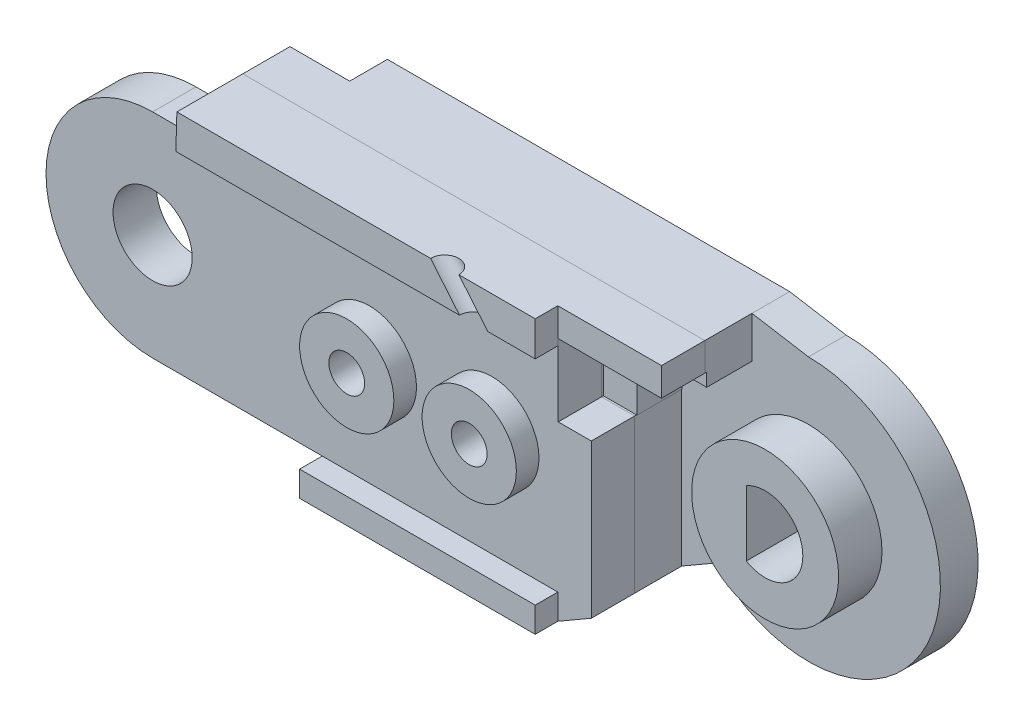
from build123d import *

# Parameters (mm, degrees)
BOSS_EXTRUDE1_DEPTH  = 2
BOSS_EXTRUDE6_DEPTH  = 2.5
CUT_EXTRUDE6_DEPTH   = 2.5
BOSS_EXTRUDE14_DEPTH = 2.3
SKETCH32_R           = 2.1
CUT_EXTRUDE7_DEPTH   = 2.3
SKETCH33_W           = 12.5
SKETCH33_H           = 1.343145751
BOSS_EXTRUDE15_DEPTH = 1.2
SKETCH35_W           = 5.479645997
SKETCH35_H           = 3.827993755
CUT_EXTRUDE8_DEPTH   = 2.4
SKETCH36_W           = 3.7
SKETCH36_H           = 1.827993755
CUT_EXTRUDE9_DEPTH   = 2.4
SKETCH37_R           = 3.9
BOSS_EXTRUDE16_DEPTH = 2.3
CUT_EXTRUDE10_DEPTH  = 38.996578793
SKETCH43_R           = 2.5
BOSS_EXTRUDE17_DEPTH = 1.2
SKETCH44_R           = 0.95
CUT_EXTRUDE11_DEPTH  = 39.590802013
SKETCH45_R           = 2
CUT_EXTRUDE12_DEPTH  = 2.5
SKETCH52_R           = 0.75
CUT_EXTRUDE13_DEPTH  = 10


with BuildPart() as part:
    # Sketch3 → Boss-Extrude1 (new body)
    with BuildSketch(Plane.XY):
        with BuildLine():
            Line((8, 0), (9, -2.5))
            Line((9, -2.5), (9, -7))
            Line((9, -7), (21.5, -7))
            Line((21.5, -7), (25.050252532, -4.949747468))
            ThreePointArc((25.050252532, -4.949747468), (36.467156728, -2.678784027), (30, 7))
            Line((30, 7), (27, 7.5))
            Line((27, 7.5), (5.656854249, 7.5))
            Line((5.656854249, 7.5), (5.656854249, 5.656854249))
            ThreePointArc((5.656854249, 5.656854249), (7.39103626, 3.061467459), (8, 0))
        make_face()
    extrude(amount=BOSS_EXTRUDE1_DEPTH)

    # Sketch22 → Boss-Extrude6 (add)
    with BuildSketch(Plane.XY.offset(2)):
        with BuildLine():
            Line((5.656854249, 5.656854249), (2.486790148, 5.656854249))
            Line((2.486790148, 5.656854249), (2.486790148, 7.5))
            Line((2.486790148, 7.5), (5.656854249, 7.5))
            Line((5.656854249, 7.5), (21.5, 7.5))
            Line((21.5, 7.5), (27, 7.5))
            Line((27, 7.5), (27, 2.172006245))
            Line((27, 2.172006245), (23.275126266, 2.172006245))
            Line((23.275126266, 2.172006245), (23.275126266, -5.974873734))
            Line((23.275126266, -5.974873734), (21.5, -7))
            Line((21.5, -7), (9, -7))
            Line((9, -7), (9, -2.5))
            Line((9, -2.5), (8, 0))
            ThreePointArc((8, 0), (7.39103626, 3.061467459), (5.656854249, 5.656854249))
        make_face()
    extrude(amount=BOSS_EXTRUDE6_DEPTH)

    # Sketch26 → Cut-Extrude6 (cut)
    with BuildSketch(Plane.XY.offset(2)):
        Polygon((18.098080448, 5.3), (2.530052458, 5.3), (2.530052458, 4), (18.098080448, 4), (27, 4), (27, 5.3), align=None)
    extrude(amount=CUT_EXTRUDE6_DEPTH, mode=Mode.SUBTRACT)


with BuildPart() as body_2:
    # Sketch31 → Boss-Extrude14 (new body)
    with BuildSketch(Plane.XY.offset(4.5)):
        with BuildLine():
            Line((2.432688066, 5.656854249), (0, 5.656854249))
            ThreePointArc((0, 5.656854249), (-5.656854249, 0), (0, -5.656854249))
            Line((0, -5.656854249), (9, -5.656854249))
            Line((9, -5.656854249), (9, -7))
            Line((9, -7), (21.5, -7))
            Line((21.5, -7), (23.275126266, -5.974873734))
            Line((23.275126266, -5.974873734), (23.275126266, 2.172006245))
            Line((23.275126266, 2.172006245), (27, 2.172006245))
            Line((27, 2.172006245), (27, 7.5))
            Line((27, 7.5), (2.486790148, 7.5))
            Line((2.486790148, 7.5), (2.432688066, 5.656854249))
        make_face()
    extrude(amount=BOSS_EXTRUDE14_DEPTH)

    # Sketch32 → Cut-Extrude7 (cut)
    with BuildSketch(Plane.XY.offset(6.8)):
        Circle(SKETCH32_R)
    extrude(amount=-CUT_EXTRUDE7_DEPTH, mode=Mode.SUBTRACT)

    # Sketch33 → Boss-Extrude15 (add)
    with BuildSketch(Plane.XY.offset(6.8)):
        with Locations((15.25, -6.328427125)):
            Rectangle(SKETCH33_W, SKETCH33_H)
        Polygon((2.486790148, 7.5), (21.5, 7.5), (21.5, 5.656854249), (2.432688066, 5.656854249), align=None)
    extrude(amount=BOSS_EXTRUDE15_DEPTH)


with BuildPart() as cut_extrude8_tool:
    # Sketch35 → Cut-Extrude8 (new body)
    with BuildSketch(Plane.XY.offset(6.8)):
        with Locations((24.260177002, 4.086003123)):
            Rectangle(SKETCH35_W, SKETCH35_H)
    extrude(amount=-CUT_EXTRUDE8_DEPTH)


with BuildPart() as part_1:
    add(part.part)

    # Cut-Extrude8: cut by cut_extrude8_tool
    add(cut_extrude8_tool.part, mode=Mode.SUBTRACT)

    # Sketch36 → Cut-Extrude9 (cut)
    with BuildSketch(Plane.XY.offset(4.4)):
        with Locations((25.15, 3.086003123)):
            Rectangle(SKETCH36_W, SKETCH36_H)
    extrude(amount=-CUT_EXTRUDE9_DEPTH, mode=Mode.SUBTRACT)

    # Sketch37 → Boss-Extrude16 (add)
    with BuildSketch(Plane.XY.offset(2)):
        with Locations((30, 0)):
            Circle(SKETCH37_R)
    extrude(amount=BOSS_EXTRUDE16_DEPTH)

    # Sketch39 → Cut-Extrude10 (cut, through all)
    with BuildSketch(Plane.XY.offset(4.3)):
        with BuildLine():
            Line((29, 1.732050808), (29, -1.732050808))
            ThreePointArc((29, -1.732050808), (32, 0), (29, 1.732050808))
        make_face()
    extrude(amount=-CUT_EXTRUDE10_DEPTH, mode=Mode.SUBTRACT)


with BuildPart() as body_2_1:
    add(body_2.part)

    # Cut-Extrude8: cut by cut_extrude8_tool
    add(cut_extrude8_tool.part, mode=Mode.SUBTRACT)

    # Sketch43 → Boss-Extrude17 (add)
    with BuildSketch(Plane.XY.offset(6.8)):
        with Locations((11.5, 0)):
            Circle(SKETCH43_R)
        with Locations((18, 0)):
            Circle(SKETCH43_R)
    extrude(amount=BOSS_EXTRUDE17_DEPTH)


with BuildPart() as cut_extrude11_tool:
    # Sketch44 → Cut-Extrude11 (new, through all)
    with BuildSketch(Plane.XY.offset(8)):
        with Locations((11.5, 0)):
            Circle(SKETCH44_R)
        with Locations((18, 0)):
            Circle(SKETCH44_R)
    extrude(amount=-CUT_EXTRUDE11_DEPTH)


with BuildPart() as part_2:
    add(part_1.part)

    # Cut-Extrude11: cut by cut_extrude11_tool
    add(cut_extrude11_tool.part, mode=Mode.SUBTRACT)

    # Sketch45 → Cut-Extrude12 (cut)
    with BuildSketch(Plane(origin=(0, 0, 0), x_dir=(-1, 0, 0), z_dir=(0, 0, -1))):
        with Locations((-11.5, 0)):
            Circle(SKETCH45_R)
        with Locations((-18, 0)):
            Circle(SKETCH45_R)
    extrude(amount=-CUT_EXTRUDE12_DEPTH, mode=Mode.SUBTRACT)


with BuildPart() as body_2_2:
    add(body_2_1.part)

    # Cut-Extrude11: cut by cut_extrude11_tool
    add(cut_extrude11_tool.part, mode=Mode.SUBTRACT)

    # Sketch52 → Cut-Extrude13 (cut, along a direction that is not the sketch's normal)
    with BuildSketch(Plane.XZ.offset(-5.656854249)):
        with Locations((18.235476819, 8)):
            Circle(SKETCH52_R)
    extrude(amount=-CUT_EXTRUDE13_DEPTH, dir=(0.6404101962115248, -0.7680330595673056, 0), mode=Mode.SUBTRACT)


solid = Compound([part_2.part, body_2_2.part])
